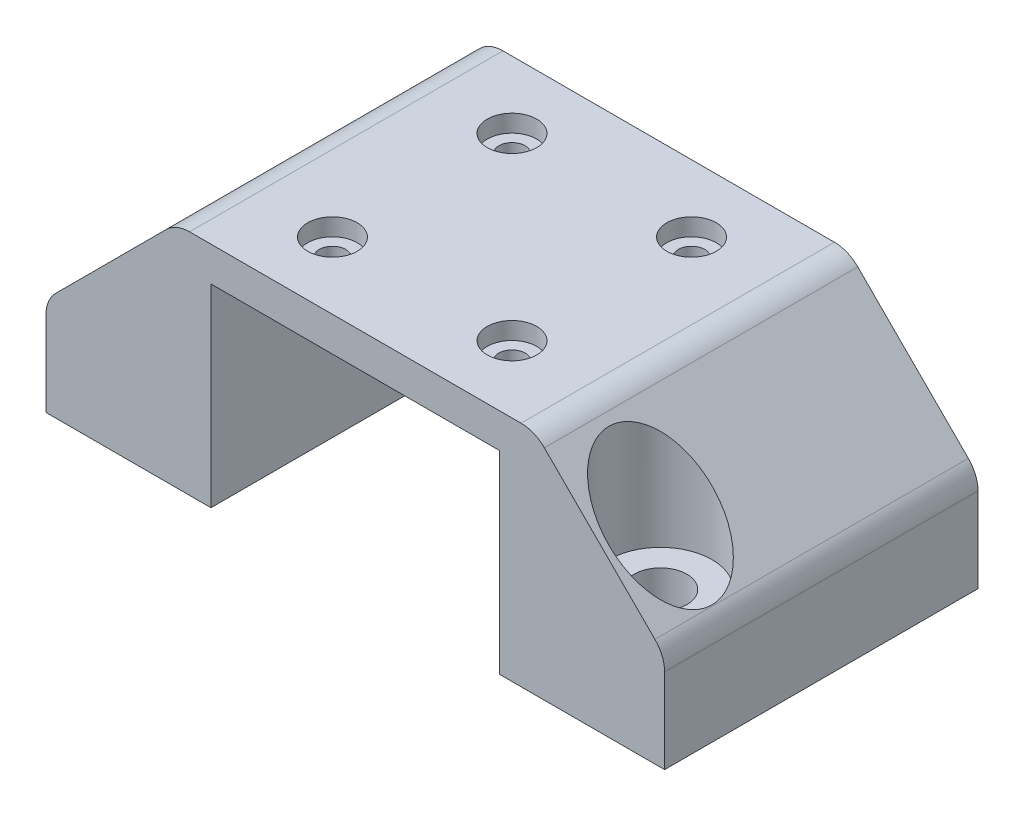
from build123d import *

# Parameters (mm, degrees)
BOSS_EXTRUDE1_DEPTH = 24.13
CHAMFER1_SIZE       = 10
FILLET1_R           = 2.54
FILLET2_R           = 2.54
SKETCH2_R           = 2.032
CUT_EXTRUDE1_DEPTH  = 10.16
SKETCH3_R           = 1.016
CUT_EXTRUDE2_DEPTH  = 39.185845946
SKETCH4_R           = 1.905
CUT_EXTRUDE3_DEPTH  = 1.3335
SKETCH5_R           = 2.032
CUT_EXTRUDE4_DEPTH  = 8.89
SKETCH7_R           = 3.96875
CUT_EXTRUDE5_DEPTH  = 10.16


with BuildPart() as part:
    # Sketch1 → Boss-Extrude1 (new body)
    with BuildSketch(Plane.XY):
        Polygon((-11.1125, 0), (-11.1125, 14.9225), (11.1125, 14.9225), (11.1125, 0), (23.8125, 0), (23.8125, 17.574605951), (-23.8125, 17.574605951), (-23.8125, 0), align=None)
    extrude(amount=BOSS_EXTRUDE1_DEPTH)

    # Chamfer1
    chamfer1_edges = [part.edges().sort_by_distance(p)[0] for p in [
        (23.8125, 17.574605951, 12.065),
        (-23.8125, 17.574605951, 12.065),
    ]]
    chamfer(chamfer1_edges, length=CHAMFER1_SIZE)

    # Fillet1
    fillet1_edges = [part.edges().sort_by_distance(p)[0] for p in [
        (13.8125, 17.574605951, 12.065),
        (-13.8125, 17.574605951, 12.065),
    ]]
    fillet(fillet1_edges, radius=FILLET1_R)

    # Fillet2
    fillet2_edges = [part.edges().sort_by_distance(p)[0] for p in [
        (23.8125, 7.574605951, 12.065),
        (-23.8125, 7.574605951, 12.065),
    ]]
    fillet(fillet2_edges, radius=FILLET2_R)

    # Sketch2 → Cut-Extrude1 (cut)
    with BuildSketch(Plane.XZ):
        with Locations((-19.05, 19.685)):
            Circle(SKETCH2_R)
        with Locations((19.05, 19.685)):
            Circle(SKETCH2_R)
    extrude(amount=-CUT_EXTRUDE1_DEPTH, mode=Mode.SUBTRACT)

    # Sketch3 → Cut-Extrude2 (cut, through all)
    with BuildSketch(Plane(origin=(0, 17.574605951, 0), x_dir=(1, 0, 0), z_dir=(0, 1, 0))):
        with Locations((-6.91134, -5.15366)):
            Circle(SKETCH3_R)
        with Locations((6.91134, -5.15366)):
            Circle(SKETCH3_R)
        with Locations((6.91134, -18.97634)):
            Circle(SKETCH3_R)
        with Locations((-6.91134, -18.97634)):
            Circle(SKETCH3_R)
    extrude(amount=-CUT_EXTRUDE2_DEPTH, mode=Mode.SUBTRACT)

    # Sketch4 → Cut-Extrude3 (cut)
    with BuildSketch(Plane(origin=(0, 17.574605951, 0), x_dir=(1, 0, 0), z_dir=(0, 1, 0))):
        with Locations((-6.91134, -5.15366)):
            Circle(SKETCH4_R)
        with Locations((6.91134, -5.15366)):
            Circle(SKETCH4_R)
        with Locations((6.91134, -18.97634)):
            Circle(SKETCH4_R)
        with Locations((-6.91134, -18.97634)):
            Circle(SKETCH4_R)
    extrude(amount=-CUT_EXTRUDE3_DEPTH, mode=Mode.SUBTRACT)

    # Sketch5 → Cut-Extrude4 (cut)
    with BuildSketch(Plane.XZ):
        with Locations((-19.05, 4.445)):
            Circle(SKETCH5_R)
        with Locations((19.05, 4.445)):
            Circle(SKETCH5_R)
    extrude(amount=-CUT_EXTRUDE4_DEPTH, mode=Mode.SUBTRACT)

    # Sketch7 → Cut-Extrude5 (cut)
    with BuildSketch(Plane(origin=(0, 17.574605951, 0), x_dir=(1, 0, 0), z_dir=(0, 1, 0))):
        with Locations((19.05, -19.685)):
            Circle(SKETCH7_R)
        with Locations((-19.05, -19.685)):
            Circle(SKETCH7_R)
    extrude(amount=-CUT_EXTRUDE5_DEPTH, mode=Mode.SUBTRACT)


solid = part.part
